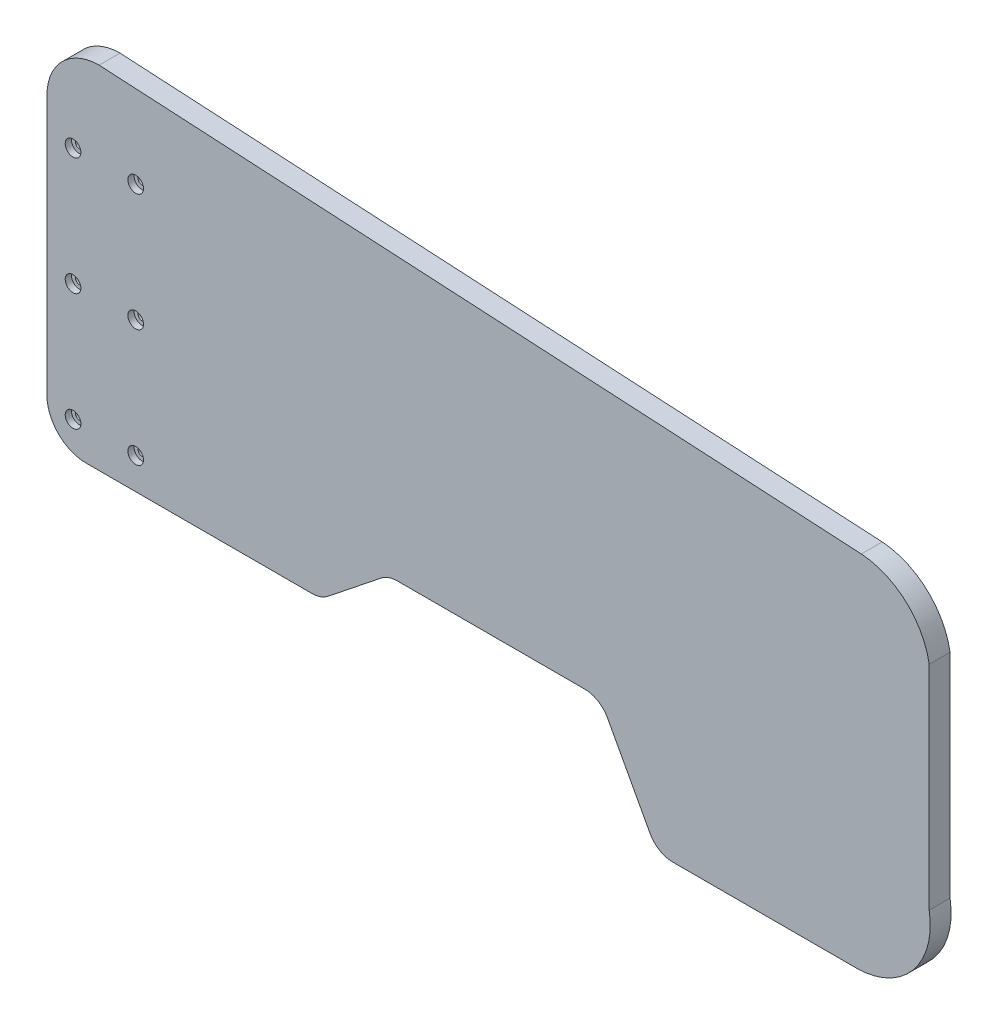
from build123d import *

# Parameters (mm, degrees)
DODANIE_WYCI_GNI_CIE1_DEPTH = 8
SZKIC1_R                    = 3.5
WYTNIJ_WYCI_GNI_CIE1_DEPTH  = 100
SZKIC3_R                    = 1.5
WYTNIJ_WYCI_GNI_CIE3_DEPTH  = 5
SZKIC5_R                    = 3
WYTNIJ_WYCI_GNI_CIE4_DEPTH  = 2.4


with BuildPart() as part:
    # outer-wire → Dodanie-wyciągnięcie1 (new body)
    with BuildSketch(Plane.XY):
        with BuildLine():
            Line((-24, -24.53020641), (62.5, -24.53020641))
            ThreePointArc((62.5, -24.53020641), (65.803504247, -23.968789974), (68.736080178, -22.347578348))
            Line((68.736080178, -22.347578348), (89, -6.182628062))
            ThreePointArc((89, -6.182628062), (91.932575931, -4.561416436), (95.236080178, -4))
            Line((95.236080178, -4), (167, -4))
            ThreePointArc((167, -4), (172.310885546, -5.526836794), (176, -9.641101056))
            Line((176, -9.641101056), (192, -39.280484771))
            ThreePointArc((192, -39.280484771), (195.676368139, -43.118069462), (200.799707694, -44.53020641))
            Line((200.799707694, -44.53020641), (271, -44.53020641))
            ThreePointArc((271, -44.53020641), (292.697243682, -34.454979346), (299, -11.3778078))
            Line((299, -11.3778078), (299, 70.236479581))
            ThreePointArc((299, 70.236479581), (290.082226047, 86.530998263), (273, 93.827270232))
            Line((273, 93.827270232), (-19, 110))
            ThreePointArc((-19, 110), (-33.142135624, 104.142135624), (-39, 90))
            Line((-39, 90), (-39, -9.53020641))
            ThreePointArc((-39, -9.53020641), (-34.606601718, -20.136808128), (-24, -24.53020641))
        make_face()
    extrude(amount=DODANIE_WYCI_GNI_CIE1_DEPTH)

    # Szkic1 → Wytnij-wyciągnięcie1 (cut)
    with BuildSketch(Plane(origin=(0, -24.53020641, 0), x_dir=(-1, 0, 0), z_dir=(0, -1, 0))):
        with Locations((19, 0)):
            Circle(SZKIC1_R)
    extrude(amount=-WYTNIJ_WYCI_GNI_CIE1_DEPTH, mode=Mode.SUBTRACT)

    # Szkic3 → Wytnij-wyciągnięcie3 (cut)
    with BuildSketch(Plane.XY.offset(8)):
        with Locations((-5, 77.5)):
            Circle(SZKIC3_R)
        with Locations((-29, 77.5)):
            Circle(SZKIC3_R)
        with Locations((-29, -12.5)):
            Circle(SZKIC3_R)
        with Locations((-29, 32.5)):
            Circle(SZKIC3_R)
        with Locations((-5, 32.5)):
            Circle(SZKIC3_R)
        with Locations((-5, -12.5)):
            Circle(SZKIC3_R)
    extrude(amount=-WYTNIJ_WYCI_GNI_CIE3_DEPTH, mode=Mode.SUBTRACT)

    # Szkic5 → Wytnij-wyciągnięcie4 (cut)
    with BuildSketch(Plane.XY.offset(8)):
        with Locations((-29, -12.5)):
            Circle(SZKIC5_R)
        with Locations((-29, 32.5)):
            Circle(SZKIC5_R)
        with Locations((-29, 77.5)):
            Circle(SZKIC5_R)
        with Locations((-5, 77.5)):
            Circle(SZKIC5_R)
        with Locations((-5, 32.5)):
            Circle(SZKIC5_R)
        with Locations((-5, -12.5)):
            Circle(SZKIC5_R)
    extrude(amount=-WYTNIJ_WYCI_GNI_CIE4_DEPTH, mode=Mode.SUBTRACT)


solid = part.part
